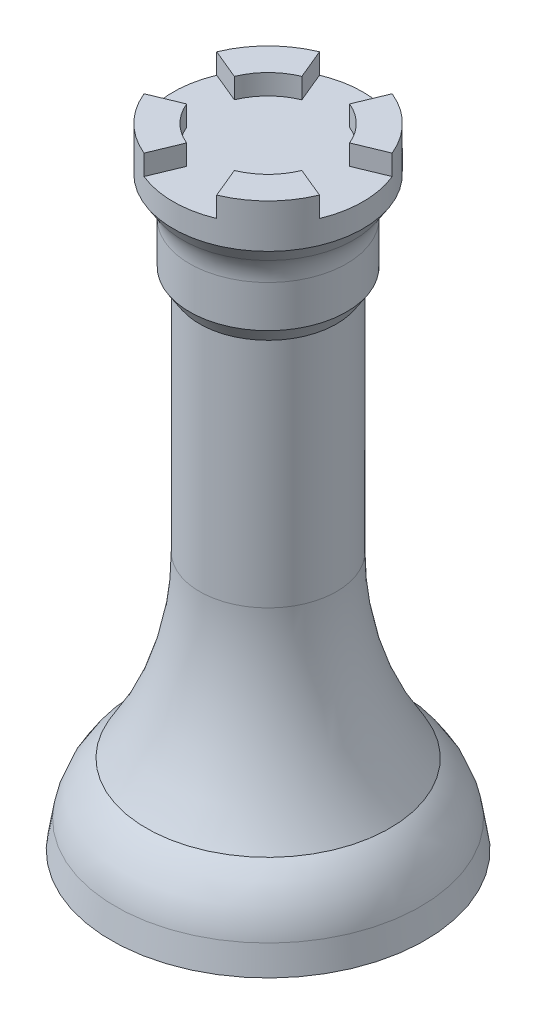
from build123d import *

# Parameters (mm, degrees)
SKETCH1_3_W        = 2.41
SKETCH1_3_H        = 1.5
CUT_REVOLVE1_ANGLE = 45
CIRPATTERN1_COUNT  = 4


with BuildPart() as part:
    # Sketch1 → Revolve5 (revolve)
    with BuildSketch(Plane.XY):
        with BuildLine():
            Line((-7.010318738, -9.284917782), (4.589681262, -9.284917782))
            Line((4.589681262, -9.284917782), (4.589681262, 35.715082218))
            Line((4.589681262, 35.715082218), (-0.020318738, 35.715082218))
            Line((-0.020318738, 35.715082218), (-0.020318738, 37.215082218))
            Line((-0.020318738, 37.215082218), (-2.430318738, 37.215082218))
            Line((-2.430318738, 37.215082218), (-2.430318738, 33.985082218))
            Line((-2.430318738, 33.985082218), (-1.735040384, 32.910378534))
            ThreePointArc((-1.735040384, 32.910378534), (-1.343438221, 32.058018495), (-1.209241973, 31.129653665))
            Line((-1.209241973, 31.129653665), (-1.209241973, 28.047788417))
            Line((-1.209241973, 28.047788417), (-0.472655293, 26.909233745))
            Line((-0.472655293, 26.909233745), (-0.472655293, 9.778863627))
            ThreePointArc((-0.472655293, 9.778863627), (-1.478108998, 2.901044306), (-4.410318738, -3.401136412))
            ThreePointArc((-4.410318738, -3.401136412), (-5.901404916, -5.134443013), (-6.678030973, -7.284917782))
            Line((-6.678030973, -7.284917782), (-7.010318738, -9.284917782))
        make_face()
    revolve(axis=Axis((4.589681262, -9.284917782, 0), (0, 1, 0)))

    # Sketch1<3> → Cut-Revolve1 (revolve, symmetric, cut)
    with BuildSketch(Plane.XY) as cut_revolve1_sk:
        with Locations((-1.225318738, 36.465082218)):
            Rectangle(SKETCH1_3_W, SKETCH1_3_H)
    cut_revolve1 = revolve(axis=Axis((4.589681262, -9.284917782, 0), (0, 1, 0)), revolution_arc=CUT_REVOLVE1_ANGLE / 2, mode=Mode.SUBTRACT)
    cut_revolve1 = cut_revolve1 + revolve(cut_revolve1_sk.sketch, axis=Axis((4.589681262, -9.284917782, 0), (0, -1, 0)), revolution_arc=CUT_REVOLVE1_ANGLE / 2, mode=Mode.SUBTRACT)

    # CirPattern1: Cut-Revolve1 ×4 about axis
    cirpattern1_axis = Axis((4.589681262, -9.284917782, 0), (0, 1, 0))
    for i in range(1, CIRPATTERN1_COUNT):
        add(cut_revolve1.rotate(cirpattern1_axis, i * 360 / CIRPATTERN1_COUNT), mode=Mode.SUBTRACT)


solid = part.part
